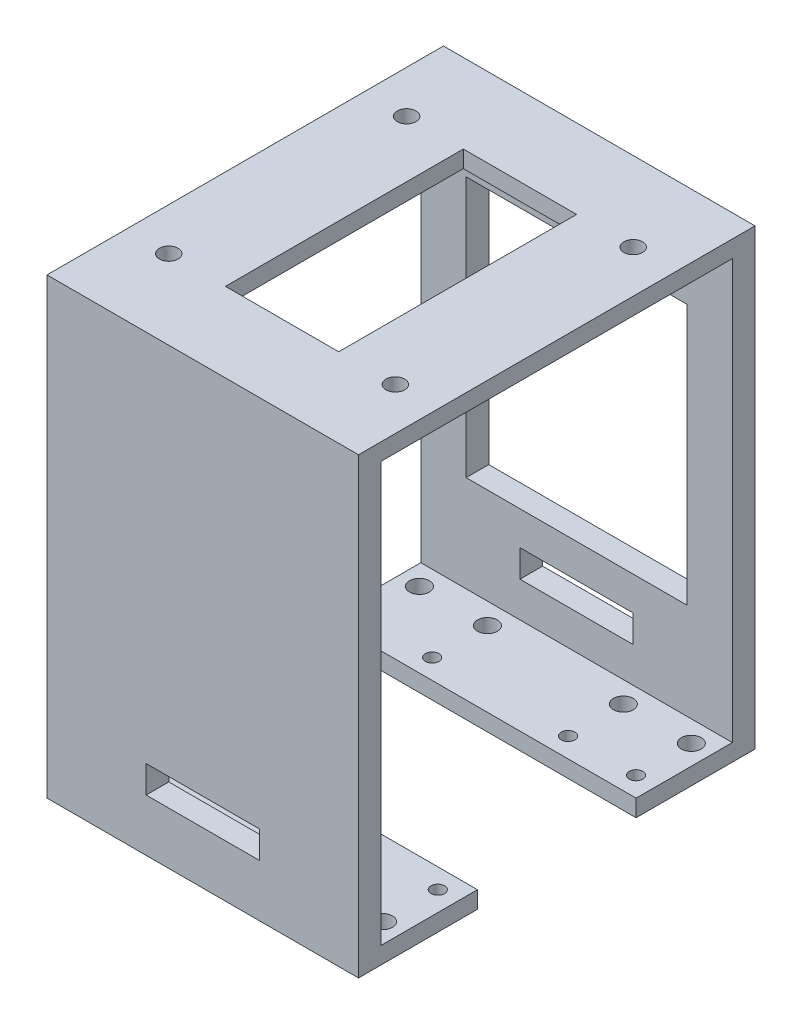
from build123d import *

# Parameters (mm, degrees)
SKETCH1_W                 = 75
SKETCH1_H                 = 40
SKETCH1_R                 = 5
SKETCH1_R_2               = 1.7
SKETCH1_W_2               = 10
SKETCH1_H_2               = 20
BOSS_EXTRUDE1_DEPTH       = 3
CUT_EXTRUDE1_DEPTH        = 43.605750786
CUT_EXTRUDE1_DEPTH_BACK   = 43.605750786
SKETCH2_W                 = 67
SKETCH2_H                 = 28
BOSS_EXTRUDE3_DEPTH       = 110
BOSS_EXTRUDE3_DEPTH_BACK  = 3
SKETCH3_W                 = 75
SKETCH3_H                 = 70
SKETCH3_W_2               = 67
SKETCH3_H_2               = 40
SKETCH6_W                 = 67
SKETCH6_H                 = 11
CUT_EXTRUDE4_DEPTH        = 122.372360939
SKETCH7_W                 = 70
SKETCH7_H                 = 37
BOSS_EXTRUDE4_DEPTH       = 45
SKETCH8_W                 = 45
SKETCH8_H                 = 62
CUT_EXTRUDE6_DEPTH        = 29
SKETCH11_W                = 45
SKETCH11_H                = 4
CUT_EXTRUDE9_DEPTH        = 157.445677473
SKETCH9_W                 = 38
SKETCH9_H                 = 28.5
CUT_EXTRUDE10_DEPTH       = 204.024629048
SKETCH13_W                = 5
SKETCH13_H                = 38
BOSS_EXTRUDE5_DEPTH       = 32
SKETCH14_R                = 5
SKETCH14_R_2              = 1.7
CUT_EXTRUDE11_DEPTH       = 32
SKETCH15_W                = 165
SKETCH15_H                = 70
SKETCH15_W_2              = 157
SKETCH15_H_2              = 62
BOSS_EXTRUDE6_DEPTH       = 3
SKETCH16_W                = 20
SKETCH16_H                = 4.820648258
CUT_EXTRUDE12_DEPTH       = 159.626132778
SKETCH18_R                = 5
CUT_EXTRUDE14_DEPTH       = 159.626132778
MIRROR6_COPY_1_SKETCH_W   = 5
MIRROR6_COPY_1_SKETCH_H   = 38
MIRROR6_COPY_1_DEPTH      = 32
MIRROR6_COPY_2_SKETCH_R   = 5
MIRROR6_COPY_2_SKETCH_R_2 = 1.7
MIRROR6_COPY_2_DEPTH      = 32
MIRROR6_COPY_3_SKETCH_W   = 5
MIRROR6_COPY_3_SKETCH_H   = 38
MIRROR6_COPY_3_DEPTH      = 32
MIRROR6_COPY_4_SKETCH_R   = 5
MIRROR6_COPY_4_SKETCH_R_2 = 1.7
MIRROR6_COPY_4_DEPTH      = 32
SKETCH19_W                = 38
SKETCH19_H                = 3.5
CUT_EXTRUDE15_DEPTH       = 10
SKETCH20_R                = 1.2
CUT_EXTRUDE16_DEPTH       = 10
SKETCH21_W                = 10
SKETCH21_H                = 80
CUT_EXTRUDE17_DEPTH       = 184.330984833
SKETCH22_W                = 172.739058827
SKETCH22_H                = 75.843231067
CUT_EXTRUDE18_DEPTH       = 184.330984833
SKETCH23_W                = 55
SKETCH23_H                = 70
BOSS_EXTRUDE7_DEPTH       = 3
SKETCH24_R                = 10
SKETCH24_R_2              = 1.65
CUT_EXTRUDE19_DEPTH       = 3
SKETCH25_R                = 1.75
CUT_EXTRUDE20_DEPTH       = 10
SKETCH27_W                = 39
SKETCH27_H                = 46
CUT_EXTRUDE21_DEPTH       = 4
SKETCH29_W                = 20
SKETCH29_H                = 42
CUT_EXTRUDE22_DEPTH       = 10


with BuildPart() as part:
    # Sketch1 → Boss-Extrude1 (new body)
    with BuildSketch(Plane(origin=(0, 0, 0), x_dir=(1, 0, 0), z_dir=(0, 1, 0))):
        Rectangle(SKETCH1_W, SKETCH1_H)
        with Locations((-21, 0)):
            Circle(SKETCH1_R, mode=Mode.SUBTRACT)
        with Locations((-30, 8.25)):
            Circle(SKETCH1_R_2, mode=Mode.SUBTRACT)
        with Locations((-12, 8.25)):
            Circle(SKETCH1_R_2, mode=Mode.SUBTRACT)
        with Locations((-12, -8.25)):
            Circle(SKETCH1_R_2, mode=Mode.SUBTRACT)
        with Locations((-30, -8.25)):
            Circle(SKETCH1_R_2, mode=Mode.SUBTRACT)
        with Locations((12, 8.25)):
            Circle(SKETCH1_R_2, mode=Mode.SUBTRACT)
        with Locations((12, -8.25)):
            Circle(SKETCH1_R_2, mode=Mode.SUBTRACT)
        with Locations((21, 0)):
            Circle(SKETCH1_R, mode=Mode.SUBTRACT)
        with Locations((30, -8.25)):
            Circle(SKETCH1_R_2, mode=Mode.SUBTRACT)
        with Locations((30, 8.25)):
            Circle(SKETCH1_R_2, mode=Mode.SUBTRACT)
        Rectangle(SKETCH1_W_2, SKETCH1_H_2, mode=Mode.SUBTRACT)
    extrude(amount=BOSS_EXTRUDE1_DEPTH)

    # Sketch2 → Cut-Extrude1 (cut, two sides: drawn at the far end of the back side and taken through both)
    with BuildSketch(Plane(origin=(0, 3, 0), x_dir=(1, 0, 0), z_dir=(0, 1, 0)).offset(-CUT_EXTRUDE1_DEPTH_BACK)):
        Rectangle(SKETCH2_W, SKETCH2_H)
    extrude(amount=CUT_EXTRUDE1_DEPTH + CUT_EXTRUDE1_DEPTH_BACK, mode=Mode.SUBTRACT)

    # Sketch3 → Boss-Extrude3 (add, two sides: drawn at the far end of the back side and taken through both)
    with BuildSketch(Plane(origin=(0, 3, 0), x_dir=(1, 0, 0), z_dir=(0, 1, 0)).offset(-BOSS_EXTRUDE3_DEPTH_BACK)):
        Rectangle(SKETCH3_W, SKETCH3_H)
        Rectangle(SKETCH3_W_2, SKETCH3_H_2, mode=Mode.SUBTRACT)
    extrude(amount=BOSS_EXTRUDE3_DEPTH + BOSS_EXTRUDE3_DEPTH_BACK)

    # Sketch6 → Cut-Extrude4 (cut, through all)
    with BuildSketch(Plane(origin=(0, 3, 0), x_dir=(1, 0, 0), z_dir=(0, 1, 0))):
        with Locations((0, -25.5)):
            Rectangle(SKETCH6_W, SKETCH6_H)
        with Locations((0, 25.5)):
            Rectangle(SKETCH6_W, SKETCH6_H)
    extrude(amount=CUT_EXTRUDE4_DEPTH, mode=Mode.SUBTRACT)

    # Sketch7 → Boss-Extrude4 (add)
    with BuildSketch(Plane.ZY.offset(37.5)):
        with Locations((0, 94.5)):
            Rectangle(SKETCH7_W, SKETCH7_H)
    boss_extrude4 = extrude(amount=BOSS_EXTRUDE4_DEPTH)

    # Mirror2: Boss-Extrude4 across plane
    add(boss_extrude4.mirror(Plane(origin=(0, 0, 0), x_dir=(0, 0, 1), z_dir=(1, 0, 0))))

    # Sketch8 → Cut-Extrude6 (cut)
    with BuildSketch(Plane(origin=(0, 113, 0), x_dir=(1, 0, 0), z_dir=(0, 1, 0))):
        with Locations((-56, 0)):
            Rectangle(SKETCH8_W, SKETCH8_H)
        with Locations((56, 0)):
            Rectangle(SKETCH8_W, SKETCH8_H)
    extrude(amount=-CUT_EXTRUDE6_DEPTH, mode=Mode.SUBTRACT)

    # Sketch11 → Cut-Extrude9 (cut, through all)
    with BuildSketch(Plane.XY.offset(35)):
        with Locations((-60, 78)):
            Rectangle(SKETCH11_W, SKETCH11_H)
        with Locations((60, 78)):
            Rectangle(SKETCH11_W, SKETCH11_H)
    extrude(amount=-CUT_EXTRUDE9_DEPTH, mode=Mode.SUBTRACT)

    # Sketch9 → Cut-Extrude10 (cut, through all)
    with BuildSketch(Plane.ZY.offset(82.5)):
        with Locations((0, 98.25)):
            Rectangle(SKETCH9_W, SKETCH9_H)
    extrude(amount=-CUT_EXTRUDE10_DEPTH, mode=Mode.SUBTRACT)

    # Sketch13 → Boss-Extrude5 (add)
    with BuildSketch(Plane(origin=(0, 84, 0), x_dir=(1, 0, 0), z_dir=(0, 1, 0))):
        with Locations((-54.5, 0)):
            Rectangle(SKETCH13_W, SKETCH13_H)
    boss_extrude5 = extrude(amount=BOSS_EXTRUDE5_DEPTH)

    # Sketch14 → Cut-Extrude11 (cut)
    with BuildSketch(Plane.ZY.offset(57)):
        with Locations((0, 98.25)):
            Circle(SKETCH14_R)
        with Locations((-9, 106.5)):
            Circle(SKETCH14_R_2)
        with Locations((9, 106.5)):
            Circle(SKETCH14_R_2)
        with Locations((9, 90)):
            Circle(SKETCH14_R_2)
        with Locations((-9, 90)):
            Circle(SKETCH14_R_2)
    cut_extrude11 = extrude(amount=-CUT_EXTRUDE11_DEPTH, mode=Mode.SUBTRACT)

    # Mirror4: Boss-Extrude5, Cut-Extrude11 across plane
    add(boss_extrude5.mirror(Plane(origin=(0, 0, 0), x_dir=(0, 0, 1), z_dir=(1, 0, 0))))
    add(cut_extrude11.mirror(Plane(origin=(0, 0, 0), x_dir=(0, 0, 1), z_dir=(1, 0, 0))), mode=Mode.SUBTRACT)

    # Sketch15 → Boss-Extrude6 (add)
    with BuildSketch(Plane(origin=(0, 113, 0), x_dir=(1, 0, 0), z_dir=(0, 1, 0))):
        Rectangle(SKETCH15_W, SKETCH15_H)
        Rectangle(SKETCH15_W_2, SKETCH15_H_2, mode=Mode.SUBTRACT)
    extrude(amount=BOSS_EXTRUDE6_DEPTH)

    # Sketch16 → Cut-Extrude12 (cut, through all)
    with BuildSketch(Plane.XY.offset(35)):
        with Locations((0, 11.636111214)):
            Rectangle(SKETCH16_W, SKETCH16_H)
    extrude(amount=-CUT_EXTRUDE12_DEPTH, mode=Mode.SUBTRACT)

    # Sketch18 → Cut-Extrude14 (cut, through all)
    with BuildSketch(Plane.XY.offset(35)):
        with Locations((67.75, 100)):
            Circle(SKETCH18_R)
    cut_extrude14 = extrude(amount=-CUT_EXTRUDE14_DEPTH, mode=Mode.SUBTRACT)

    # Mirror5: Cut-Extrude14 across plane
    add(cut_extrude14.mirror(Plane(origin=(0, 0, 0), x_dir=(0, 0, 1), z_dir=(1, 0, 0))), mode=Mode.SUBTRACT)

    # Mirror6 copy 1 sketch → Mirror6 copy 1 (add)
    with BuildSketch(Plane(origin=(0, 148, 0), x_dir=(-1, 0, 0), z_dir=(0, -1, 0))):
        with Locations((-54.5, 0)):
            Rectangle(MIRROR6_COPY_1_SKETCH_W, MIRROR6_COPY_1_SKETCH_H)
    extrude(amount=MIRROR6_COPY_1_DEPTH)

    # Mirror6 copy 2 sketch → Mirror6 copy 2 (cut)
    with BuildSketch(Plane(origin=(57, 232, 0), x_dir=(0, 0, 1), z_dir=(1, 0, 0))):
        with Locations((0, 98.25)):
            Circle(MIRROR6_COPY_2_SKETCH_R)
        with Locations((-9, 106.5)):
            Circle(MIRROR6_COPY_2_SKETCH_R_2)
        with Locations((9, 106.5)):
            Circle(MIRROR6_COPY_2_SKETCH_R_2)
        with Locations((9, 90)):
            Circle(MIRROR6_COPY_2_SKETCH_R_2)
        with Locations((-9, 90)):
            Circle(MIRROR6_COPY_2_SKETCH_R_2)
    extrude(amount=-MIRROR6_COPY_2_DEPTH, mode=Mode.SUBTRACT)

    # Mirror6 copy 3 sketch → Mirror6 copy 3 (add)
    with BuildSketch(Plane.XZ.offset(-148)):
        with Locations((-54.5, 0)):
            Rectangle(MIRROR6_COPY_3_SKETCH_W, MIRROR6_COPY_3_SKETCH_H)
    extrude(amount=MIRROR6_COPY_3_DEPTH)

    # Mirror6 copy 4 sketch → Mirror6 copy 4 (cut)
    with BuildSketch(Plane(origin=(-57, 232, 0), x_dir=(0, 0, 1), z_dir=(-1, 0, 0))):
        with Locations((0, -98.25)):
            Circle(MIRROR6_COPY_4_SKETCH_R)
        with Locations((-9, -106.5)):
            Circle(MIRROR6_COPY_4_SKETCH_R_2)
        with Locations((9, -106.5)):
            Circle(MIRROR6_COPY_4_SKETCH_R_2)
        with Locations((9, -90)):
            Circle(MIRROR6_COPY_4_SKETCH_R_2)
        with Locations((-9, -90)):
            Circle(MIRROR6_COPY_4_SKETCH_R_2)
    extrude(amount=-MIRROR6_COPY_4_DEPTH, mode=Mode.SUBTRACT)

    # Sketch19 → Cut-Extrude15 (cut)
    with BuildSketch(Plane(origin=(82.5, 0, 0), x_dir=(0, 0, -1), z_dir=(1, 0, 0))):
        with Locations((0, 114.25)):
            Rectangle(SKETCH19_W, SKETCH19_H)
    cut_extrude15 = extrude(amount=-CUT_EXTRUDE15_DEPTH, mode=Mode.SUBTRACT)

    # Mirror7: Cut-Extrude15 across plane
    add(cut_extrude15.mirror(Plane(origin=(0, 0, 0), x_dir=(0, 0, 1), z_dir=(1, 0, 0))), mode=Mode.SUBTRACT)

    # Sketch20 → Cut-Extrude16 (cut)
    with BuildSketch(Plane(origin=(0, 3, 0), x_dir=(1, 0, 0), z_dir=(0, 1, 0))):
        with Locations((-12, 17.5)):
            Circle(SKETCH20_R)
        with Locations((-12, -17.5)):
            Circle(SKETCH20_R)
        with Locations((-24, -17.5)):
            Circle(SKETCH20_R)
        with Locations((-24, 17.5)):
            Circle(SKETCH20_R)
        with Locations((12, -17.5)):
            Circle(SKETCH20_R)
        with Locations((24, -17.5)):
            Circle(SKETCH20_R)
        with Locations((12, 17.5)):
            Circle(SKETCH20_R)
        with Locations((24, 17.5)):
            Circle(SKETCH20_R)
    extrude(amount=-CUT_EXTRUDE16_DEPTH, mode=Mode.SUBTRACT)

    # Sketch21 → Cut-Extrude17 (cut, through all)
    with BuildSketch(Plane.XY.offset(35)):
        with Locations((32.5, 40)):
            Rectangle(SKETCH21_W, SKETCH21_H)
        with Locations((-32.5, 40)):
            Rectangle(SKETCH21_W, SKETCH21_H)
    extrude(amount=-CUT_EXTRUDE17_DEPTH, mode=Mode.SUBTRACT)

    # Sketch22 → Cut-Extrude18 (cut, through all)
    with BuildSketch(Plane.XY.offset(35)):
        with Locations((-3.869529414, 117.921615534)):
            Rectangle(SKETCH22_W, SKETCH22_H)
    extrude(amount=-CUT_EXTRUDE18_DEPTH, mode=Mode.SUBTRACT)


with BuildPart() as cut_extrude18_piece_1:
    # of the separate pieces the step leaves, piece 1, a body of its own (cut_extrude18_pieces)
    add(part.part.solids().sort_by_distance((-27.5, 0, 35))[0])



with BuildPart() as cut_extrude18_piece_2:
    # of the separate pieces the step leaves, piece 2, a body of its own (cut_extrude18_pieces)
    add(part.part.solids().sort_by_distance((27.5, 0, -35))[0])


with BuildPart() as cut_extrude18_piece_1_1:
    add(cut_extrude18_piece_1.part)

    add(cut_extrude18_piece_2.part)  # Boss-Extrude7 merges Cut-Extrude18 piece 2
    # Sketch23 → Boss-Extrude7 (add)
    with BuildSketch(Plane(origin=(0, 80, 0), x_dir=(1, 0, 0), z_dir=(0, 1, 0))):
        Rectangle(SKETCH23_W, SKETCH23_H)
    extrude(amount=-BOSS_EXTRUDE7_DEPTH)

    # Sketch24 → Cut-Extrude19 (cut)
    with BuildSketch(Plane(origin=(0, 80, 0), x_dir=(1, 0, 0), z_dir=(0, 1, 0))):
        Circle(SKETCH24_R)
        with Locations((-20, 21)):
            Circle(SKETCH24_R_2)
        with Locations((-20, -21)):
            Circle(SKETCH24_R_2)
        with Locations((20, -21)):
            Circle(SKETCH24_R_2)
        with Locations((20, 21)):
            Circle(SKETCH24_R_2)
    extrude(amount=-CUT_EXTRUDE19_DEPTH, mode=Mode.SUBTRACT)

    # Sketch25 → Cut-Extrude20 (cut)
    with BuildSketch(Plane.XZ):
        with Locations((-24, 27.254904765)):
            Circle(SKETCH25_R)
        with Locations((12, -27.254904765)):
            Circle(SKETCH25_R)
        with Locations((24, -27.254904765)):
            Circle(SKETCH25_R)
        with Locations((12, 27.254904765)):
            Circle(SKETCH25_R)
        with Locations((-12, 27.254904765)):
            Circle(SKETCH25_R)
        with Locations((-24, -27.254904765)):
            Circle(SKETCH25_R)
        with Locations((-12, -27.254904765)):
            Circle(SKETCH25_R)
        with Locations((24, 27.254904765)):
            Circle(SKETCH25_R)
    extrude(amount=-CUT_EXTRUDE20_DEPTH, mode=Mode.SUBTRACT)

    # Sketch27 → Cut-Extrude21 (cut)
    with BuildSketch(Plane(origin=(0, 0, -35), x_dir=(-1, 0, 0), z_dir=(0, 0, -1))):
        with Locations((0, 43)):
            Rectangle(SKETCH27_W, SKETCH27_H)
    extrude(amount=-CUT_EXTRUDE21_DEPTH, mode=Mode.SUBTRACT)

    # Sketch29 → Cut-Extrude22 (cut)
    with BuildSketch(Plane(origin=(0, 80, 0), x_dir=(1, 0, 0), z_dir=(0, 1, 0))):
        Rectangle(SKETCH29_W, SKETCH29_H)
    extrude(amount=-CUT_EXTRUDE22_DEPTH, mode=Mode.SUBTRACT)


solid = cut_extrude18_piece_1_1.part
